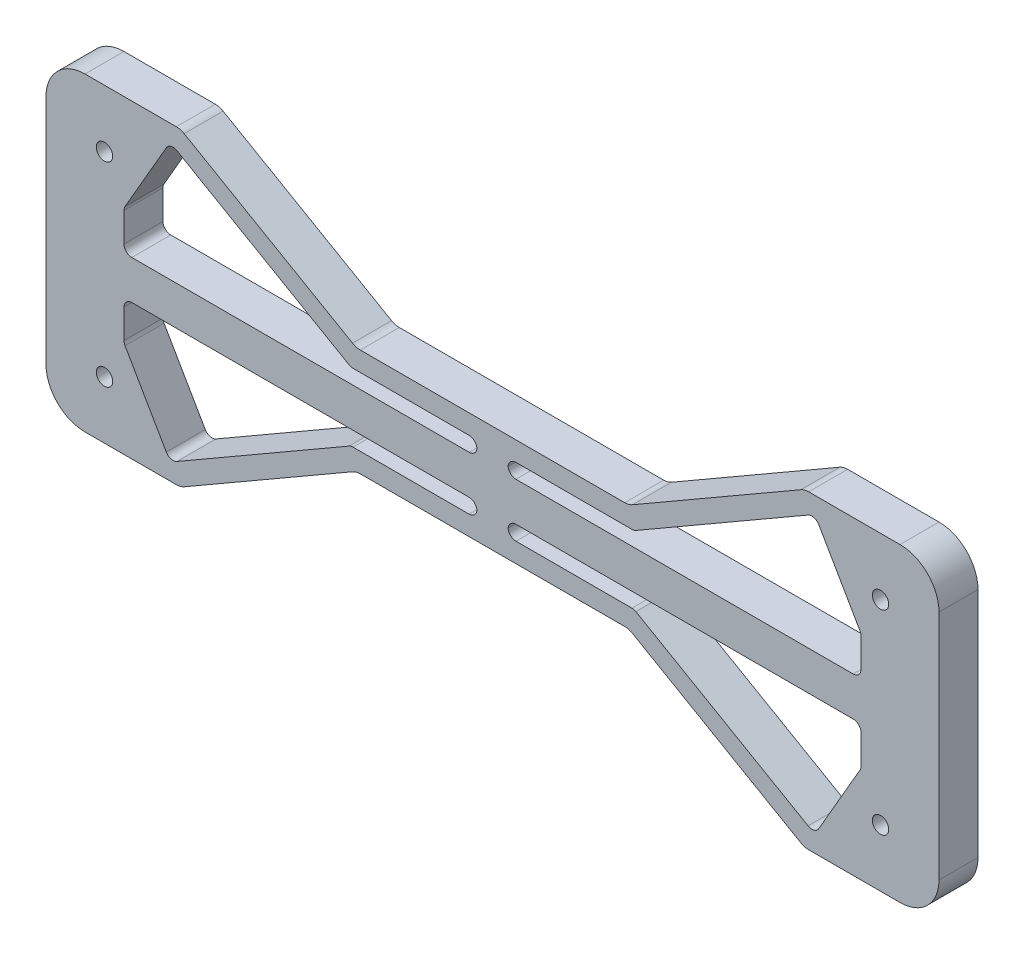
from build123d import *

# Parameters (mm, degrees)
SKETCH_1_W          = 229
SKETCH_1_H          = 79.5
EXTRUDE_1_DEPTH     = 10
FILLET_1_R          = 10
SKETCH_2_R          = 2.1
CUT_EXTRUDE_1_DEPTH = 122.615428709
CUT_EXTRUDE_2_DEPTH = 4.5
CUT_EXTRUDE_3_DEPTH = 122.615428709
FILLET_2_R          = 4
CUT_EXTRUDE_4_DEPTH = 122.615428709
FILLET_3_R          = 2


with BuildPart() as part:
    # 草图1 → 凸台-拉伸1 (new body)
    with BuildSketch(Plane.XY):
        Rectangle(SKETCH_1_W, SKETCH_1_H)
    extrude(amount=EXTRUDE_1_DEPTH)

    # 圆角1
    fillet_1_edges = [part.edges().sort_by_distance(p)[0] for p in [
        (114.5, -39.75, 5),
        (-114.5, -39.75, 5),
        (-114.5, 39.75, 5),
        (114.5, 39.75, 5),
    ]]
    fillet(fillet_1_edges, radius=FILLET_1_R)

    # 草图2 → 切除-拉伸1 (cut, through all)
    with BuildSketch(Plane(origin=(0, 0, 0), x_dir=(-1, 0, 0), z_dir=(0, 0, -1))):
        with Locations((99.5, 25)):
            Circle(SKETCH_2_R)
        with Locations(Location((99.5, -25, 0), (0, 0, 180))):
            Circle(SKETCH_2_R)
        with Locations((-99.5, -25)):
            Circle(SKETCH_2_R)
        with Locations(Location((-99.5, 25, 0), (0, 0, 180))):
            Circle(SKETCH_2_R)
    extrude(amount=-CUT_EXTRUDE_1_DEPTH, mode=Mode.SUBTRACT)

    # 草图3 → 切除-拉伸2 (cut)
    with BuildSketch(Plane(origin=(0, 0, 0), x_dir=(-1, 0, 0), z_dir=(0, 0, -1))):
        Polygon((-97.392671517, 21.35), (-95.285343035, 25), (-97.392671517, 28.65), (-101.607328483, 28.65), (-103.714656965, 25), (-101.607328483, 21.35), align=None)
        Polygon((-97.392671517, -28.65), (-95.285343035, -25), (-97.392671517, -21.35), (-101.607328483, -21.35), (-103.714656965, -25), (-101.607328483, -28.65), align=None)
        Polygon((101.607328483, 21.35), (103.714656965, 25), (101.607328483, 28.65), (97.392671517, 28.65), (95.285343035, 25), (97.392671517, 21.35), align=None)
        Polygon((101.607328483, -28.65), (103.714656965, -25), (101.607328483, -21.35), (97.392671517, -21.35), (95.285343035, -25), (97.392671517, -28.65), align=None)
    extrude(amount=-CUT_EXTRUDE_2_DEPTH, mode=Mode.SUBTRACT)

    # 草图4 → 切除-拉伸3 (cut, through all)
    with BuildSketch(Plane(origin=(0, 0, 0), x_dir=(-1, 0, 0), z_dir=(0, 0, -1))):
        Polygon((-80, 39.75), (-34.966679003, 13.75), (34.966679003, 13.75), (80, 39.75), align=None)
        Polygon((80, -39.75), (34.966679003, -13.75), (-34.966679003, -13.75), (-80, -39.75), align=None)
    extrude(amount=-CUT_EXTRUDE_3_DEPTH, mode=Mode.SUBTRACT)

    # 圆角2
    fillet_2_edges = [part.edges().sort_by_distance(p)[0] for p in [
        (80, 39.75, 5),
        (-80, 39.75, 5),
        (-34.966679003, 13.75, 5),
        (34.966679003, 13.75, 5),
        (-80, -39.75, 5),
        (80, -39.75, 5),
        (34.966679003, -13.75, 5),
        (-34.966679003, -13.75, 5),
    ]]
    fillet(fillet_2_edges, radius=FILLET_2_R)

    # 草图6 → 切除-拉伸4 (cut, through all)
    with BuildSketch(Plane(origin=(0, 0, 0), x_dir=(-1, 0, 0), z_dir=(0, 0, -1))):
        Polygon((-82.657935628, 35.511057159), (-94.5, 15), (-94.5, 5), (-4, 5), (-4, 8.75), (-36.306424965, 8.75), align=None)
        Polygon((36.306424965, 8.75), (82.657935628, 35.511057159), (94.5, 15), (94.5, 5), (4, 5), (4, 8.75), align=None)
        Polygon((82.657935628, -35.511057159), (94.5, -15), (94.5, -5), (4, -5), (4, -8.75), (36.306424965, -8.75), align=None)
        Polygon((-36.306424965, -8.75), (-82.657935628, -35.511057159), (-94.5, -15), (-94.5, -5), (-4, -5), (-4, -8.75), align=None)
    extrude(amount=-CUT_EXTRUDE_4_DEPTH, mode=Mode.SUBTRACT)

    # 圆角3
    # the kernel refuses this fillet: 2 mm, written as the material it adds along each edge
    with BuildSketch(Plane(origin=(4, 8.75, 0), x_dir=(0, -1, 0), z_dir=(0, 0, 1)), Plane(origin=(94.5, 5, 0), x_dir=(0, 1, 0), z_dir=(0, 0, 1)), Plane(origin=(4, 5, 0), x_dir=(1, 0, 0), z_dir=(0, 0, 1)), Plane(origin=(-82.657935628, 35.511057159, 0), x_dir=(-0.499999999999999, -0.8660254037844393, 0), z_dir=(0, 0, 1)), Plane(origin=(-4, 5, 0), x_dir=(0, 1, 0), z_dir=(0, 0, 1)), Plane(origin=(-4, 8.75, 0), x_dir=(-1, 0, 0), z_dir=(0, 0, 1)), Plane(origin=(-94.5, 5, 0), x_dir=(1, 0, 0), z_dir=(0, 0, 1)), Plane(origin=(82.657935628, -35.511057159, 0), x_dir=(0.5000000000000006, 0.8660254037844384, 0), z_dir=(0, 0, 1)), Plane(origin=(94.5, -5, 0), x_dir=(-1, 0, 0), z_dir=(0, 0, 1)), Plane(origin=(4, -5, 0), x_dir=(0, -1, 0), z_dir=(0, 0, 1)), Plane(origin=(4, -8.75, 0), x_dir=(1, 0, 0), z_dir=(0, 0, 1)), Plane(origin=(-4, -8.75, 0), x_dir=(0, 1, 0), z_dir=(0, 0, 1)), Plane(origin=(-4, -5, 0), x_dir=(-1, 0, 0), z_dir=(0, 0, 1)), Plane(origin=(-94.5, -5, 0), x_dir=(0, -1, 0), z_dir=(0, 0, 1))) as fillet_3_piece_1:
        with BuildLine():
            CenterArc((FILLET_3_R, FILLET_3_R), FILLET_3_R, 180, 90)
            Line((0, FILLET_3_R), (0, 0))
            Line((0, 0), (FILLET_3_R, 0))
        make_face()
    extrude(amount=10)
    with BuildSketch(Plane(origin=(94.5, 15, 0), x_dir=(-0.5000000000000042, 0.8660254037844363, 0), z_dir=(0, 0, 1)), Plane(origin=(-94.5, 15, 0), x_dir=(0, -1, 0), z_dir=(0, 0, 1)), Plane(origin=(94.5, -15, 0), x_dir=(0, 1, 0), z_dir=(0, 0, 1)), Plane(origin=(-94.5, -15, 0), x_dir=(0.49999999999999856, -0.8660254037844396, 0), z_dir=(0, 0, 1))) as fillet_3_piece_2:
        with BuildLine():
            CenterArc((FILLET_3_R * 0.267949192431, FILLET_3_R), FILLET_3_R, 240, 30)
            Line((-FILLET_3_R * 0.232050807569, FILLET_3_R * 0.133974596216), (0, 0))
            Line((0, 0), (FILLET_3_R * 0.267949192431, 0))
        make_face()
    extrude(amount=10)
    with BuildSketch(Plane(origin=(82.657935628, 35.511057159, 0), x_dir=(0.499999999999999, -0.8660254037844393, 0), z_dir=(0, 0, 1)), Plane(origin=(-82.657935628, -35.511057159, 0), x_dir=(-0.499999999999999, 0.8660254037844393, 0), z_dir=(0, 0, 1))) as fillet_3_piece_3:
        with BuildLine():
            CenterArc((FILLET_3_R, -FILLET_3_R), FILLET_3_R, 90, 90)
            Line((0, -FILLET_3_R), (0, 0))
            Line((0, 0), (FILLET_3_R, 0))
        make_face()
    extrude(amount=10)
    # the kernel refuses this fillet: 2 mm, written as the material it takes off along each edge
    with BuildSketch(Plane(origin=(36.306424965, 8.75, -1.339745962), x_dir=(-1, 0, 0), z_dir=(0, 0, 1)), Plane(origin=(-36.306424965, -8.75, -1.339745962), x_dir=(1, 0, 0), z_dir=(0, 0, 1))) as fillet_3_2_piece_1:
        with BuildLine():
            CenterArc((FILLET_3_R * 0.267949192431, -FILLET_3_R), FILLET_3_R, 90, 30)
            Line((-FILLET_3_R * 0.232050807569, -FILLET_3_R * 0.133974596216), (0, 0))
            Line((0, 0), (FILLET_3_R * 0.267949192431, 0))
        make_face()
    extrude(amount=12.679491924, mode=Mode.SUBTRACT)
    with BuildSketch(Plane(origin=(-36.306424965, 8.75, -1.339745962), x_dir=(1, 0, 0), z_dir=(0, 0, 1)), Plane(origin=(36.306424965, -8.75, -1.339745962), x_dir=(-1, 0, 0), z_dir=(0, 0, 1))) as fillet_3_2_piece_2:
        with BuildLine():
            CenterArc((FILLET_3_R * 0.267949192431, FILLET_3_R), FILLET_3_R, 240, 30)
            Line((-FILLET_3_R * 0.232050807569, FILLET_3_R * 0.133974596216), (0, 0))
            Line((0, 0), (FILLET_3_R * 0.267949192431, 0))
        make_face()
    extrude(amount=12.679491924, mode=Mode.SUBTRACT)


solid = part.part
